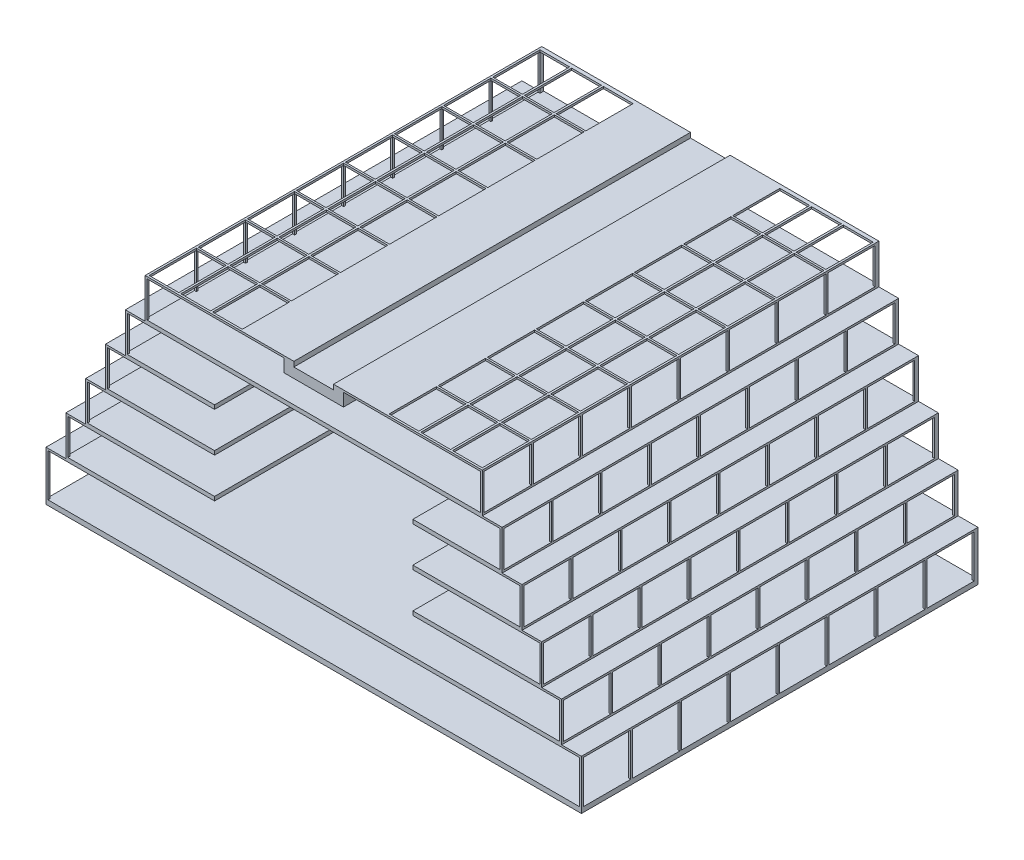
from build123d import *

# Parameters (mm, degrees)
EXTRUDE_1_DEPTH      = 40
SKETCH_2_W           = 4.77
SKETCH_2_H           = 3.6
CUT_EXTRUDE_1_DEPTH  = 11
CUT_EXTRUDE_2_REACH  = 56.351
SKETCH_3_W           = 3
SKETCH_3_H           = 4.77
SKETCH_4_W           = 4.77
SKETCH_4_H           = 3.6
CUT_EXTRUDE_3_DEPTH  = 11
SKETCH_5_W           = 4.77
SKETCH_5_H           = 3.6
CUT_EXTRUDE_4_DEPTH  = 11
SKETCH_6_W           = 4.77
SKETCH_6_H           = 3.6
CUT_EXTRUDE_5_DEPTH  = 11
SKETCH_7_W           = 4.77
SKETCH_7_H           = 3.6
CUT_EXTRUDE_6_DEPTH  = 11
SKETCH_8_W           = 4.77
SKETCH_8_H           = 4.3
CUT_EXTRUDE_7_DEPTH  = 11
SKETCH_9_W           = 37.6
SKETCH_9_H           = 3.6
SKETCH_9_W_2         = 41.6
SKETCH_9_W_3         = 45.6
SKETCH_9_W_4         = 49.6
SKETCH_9_W_5         = 53.6
SKETCH_9_H_2         = 4.3
CUT_EXTRUDE_9_DEPTH  = 55.350712967
SKETCH_10_W          = 20
SKETCH_10_H          = 12
CUT_EXTRUDE_10_DEPTH = 49


with BuildPart() as part:
    # 草图1 → 凸台-拉伸1 (new body)
    with BuildSketch(Plane.XY):
        Polygon((0, 24.5), (2, 24.5), (2, 25), (17, 25), (17, 21), (19, 21), (19, 17), (21, 17), (21, 13), (23, 13), (23, 9), (25, 9), (25, 5), (27, 5), (27, 0), (0, 0), align=None)
    extrude_1 = extrude(amount=-EXTRUDE_1_DEPTH)

    # 草图2 → 切除-拉伸1 (cut)
    with BuildSketch(Plane(origin=(17, 0, 0), x_dir=(0, 0, -1), z_dir=(1, 0, 0))):
        with Locations((2.585, 23)):
            Rectangle(SKETCH_2_W, SKETCH_2_H)
        with Locations((7.535, 23)):
            Rectangle(SKETCH_2_W, SKETCH_2_H)
        with Locations((12.485, 23)):
            Rectangle(SKETCH_2_W, SKETCH_2_H)
        with Locations((17.435, 23)):
            Rectangle(SKETCH_2_W, SKETCH_2_H)
        with Locations((22.385, 23)):
            Rectangle(SKETCH_2_W, SKETCH_2_H)
        with Locations((27.335, 23)):
            Rectangle(SKETCH_2_W, SKETCH_2_H)
        with Locations((32.285, 23)):
            Rectangle(SKETCH_2_W, SKETCH_2_H)
        with Locations((37.235, 23)):
            Rectangle(SKETCH_2_W, SKETCH_2_H)
    cut_extrude_1 = extrude(amount=-CUT_EXTRUDE_1_DEPTH, mode=Mode.SUBTRACT)

    # 草图3 → 切除-拉伸2 (cut, up to next)
    with BuildSketch(Plane(origin=(0, 25, 0), x_dir=(1, 0, 0), z_dir=(0, 1, 0)), mode=Mode.PRIVATE) as cut_extrude_2_sk1:
        with Locations((15.3, 2.585)):
            Rectangle(SKETCH_3_W, SKETCH_3_H)
    cut_extrude_2_tool1 = extrude(cut_extrude_2_sk1.sketch, amount=-CUT_EXTRUDE_2_REACH, mode=Mode.PRIVATE) & part.part
    # 草图3 → 切除-拉伸2 (cut, up to next)
    with BuildSketch(Plane(origin=(0, 25, 0), x_dir=(1, 0, 0), z_dir=(0, 1, 0)), mode=Mode.PRIVATE) as cut_extrude_2_sk2:
        with Locations((15.3, 7.535)):
            Rectangle(SKETCH_3_W, SKETCH_3_H)
    cut_extrude_2_tool2 = extrude(cut_extrude_2_sk2.sketch, amount=-CUT_EXTRUDE_2_REACH, mode=Mode.PRIVATE) & part.part
    # 草图3 → 切除-拉伸2 (cut, up to next)
    with BuildSketch(Plane(origin=(0, 25, 0), x_dir=(1, 0, 0), z_dir=(0, 1, 0)), mode=Mode.PRIVATE) as cut_extrude_2_sk3:
        with Locations((15.3, 12.485)):
            Rectangle(SKETCH_3_W, SKETCH_3_H)
    cut_extrude_2_tool3 = extrude(cut_extrude_2_sk3.sketch, amount=-CUT_EXTRUDE_2_REACH, mode=Mode.PRIVATE) & part.part
    # 草图3 → 切除-拉伸2 (cut, up to next)
    with BuildSketch(Plane(origin=(0, 25, 0), x_dir=(1, 0, 0), z_dir=(0, 1, 0)), mode=Mode.PRIVATE) as cut_extrude_2_sk4:
        with Locations((15.3, 17.435)):
            Rectangle(SKETCH_3_W, SKETCH_3_H)
    cut_extrude_2_tool4 = extrude(cut_extrude_2_sk4.sketch, amount=-CUT_EXTRUDE_2_REACH, mode=Mode.PRIVATE) & part.part
    # 草图3 → 切除-拉伸2 (cut, up to next)
    with BuildSketch(Plane(origin=(0, 25, 0), x_dir=(1, 0, 0), z_dir=(0, 1, 0)), mode=Mode.PRIVATE) as cut_extrude_2_sk5:
        with Locations((15.3, 22.385)):
            Rectangle(SKETCH_3_W, SKETCH_3_H)
    cut_extrude_2_tool5 = extrude(cut_extrude_2_sk5.sketch, amount=-CUT_EXTRUDE_2_REACH, mode=Mode.PRIVATE) & part.part
    # 草图3 → 切除-拉伸2 (cut, up to next)
    with BuildSketch(Plane(origin=(0, 25, 0), x_dir=(1, 0, 0), z_dir=(0, 1, 0)), mode=Mode.PRIVATE) as cut_extrude_2_sk6:
        with Locations((15.3, 27.335)):
            Rectangle(SKETCH_3_W, SKETCH_3_H)
    cut_extrude_2_tool6 = extrude(cut_extrude_2_sk6.sketch, amount=-CUT_EXTRUDE_2_REACH, mode=Mode.PRIVATE) & part.part
    # 草图3 → 切除-拉伸2 (cut, up to next)
    with BuildSketch(Plane(origin=(0, 25, 0), x_dir=(1, 0, 0), z_dir=(0, 1, 0)), mode=Mode.PRIVATE) as cut_extrude_2_sk7:
        with Locations((15.3, 32.285)):
            Rectangle(SKETCH_3_W, SKETCH_3_H)
    cut_extrude_2_tool7 = extrude(cut_extrude_2_sk7.sketch, amount=-CUT_EXTRUDE_2_REACH, mode=Mode.PRIVATE) & part.part
    # 草图3 → 切除-拉伸2 (cut, up to next)
    with BuildSketch(Plane(origin=(0, 25, 0), x_dir=(1, 0, 0), z_dir=(0, 1, 0)), mode=Mode.PRIVATE) as cut_extrude_2_sk8:
        with Locations((15.3, 37.235)):
            Rectangle(SKETCH_3_W, SKETCH_3_H)
    cut_extrude_2_tool8 = extrude(cut_extrude_2_sk8.sketch, amount=-CUT_EXTRUDE_2_REACH, mode=Mode.PRIVATE) & part.part
    # 草图3 → 切除-拉伸2 (cut, up to next)
    with BuildSketch(Plane(origin=(0, 25, 0), x_dir=(1, 0, 0), z_dir=(0, 1, 0)), mode=Mode.PRIVATE) as cut_extrude_2_sk9:
        with Locations((12.1, 2.585)):
            Rectangle(SKETCH_3_W, SKETCH_3_H)
    cut_extrude_2_tool9 = extrude(cut_extrude_2_sk9.sketch, amount=-CUT_EXTRUDE_2_REACH, mode=Mode.PRIVATE) & part.part
    # 草图3 → 切除-拉伸2 (cut, up to next)
    with BuildSketch(Plane(origin=(0, 25, 0), x_dir=(1, 0, 0), z_dir=(0, 1, 0)), mode=Mode.PRIVATE) as cut_extrude_2_sk10:
        with Locations((12.1, 7.535)):
            Rectangle(SKETCH_3_W, SKETCH_3_H)
    cut_extrude_2_tool10 = extrude(cut_extrude_2_sk10.sketch, amount=-CUT_EXTRUDE_2_REACH, mode=Mode.PRIVATE) & part.part
    # 草图3 → 切除-拉伸2 (cut, up to next)
    with BuildSketch(Plane(origin=(0, 25, 0), x_dir=(1, 0, 0), z_dir=(0, 1, 0)), mode=Mode.PRIVATE) as cut_extrude_2_sk11:
        with Locations((12.1, 12.485)):
            Rectangle(SKETCH_3_W, SKETCH_3_H)
    cut_extrude_2_tool11 = extrude(cut_extrude_2_sk11.sketch, amount=-CUT_EXTRUDE_2_REACH, mode=Mode.PRIVATE) & part.part
    # 草图3 → 切除-拉伸2 (cut, up to next)
    with BuildSketch(Plane(origin=(0, 25, 0), x_dir=(1, 0, 0), z_dir=(0, 1, 0)), mode=Mode.PRIVATE) as cut_extrude_2_sk12:
        with Locations((12.1, 17.435)):
            Rectangle(SKETCH_3_W, SKETCH_3_H)
    cut_extrude_2_tool12 = extrude(cut_extrude_2_sk12.sketch, amount=-CUT_EXTRUDE_2_REACH, mode=Mode.PRIVATE) & part.part
    # 草图3 → 切除-拉伸2 (cut, up to next)
    with BuildSketch(Plane(origin=(0, 25, 0), x_dir=(1, 0, 0), z_dir=(0, 1, 0)), mode=Mode.PRIVATE) as cut_extrude_2_sk13:
        with Locations((12.1, 22.385)):
            Rectangle(SKETCH_3_W, SKETCH_3_H)
    cut_extrude_2_tool13 = extrude(cut_extrude_2_sk13.sketch, amount=-CUT_EXTRUDE_2_REACH, mode=Mode.PRIVATE) & part.part
    # 草图3 → 切除-拉伸2 (cut, up to next)
    with BuildSketch(Plane(origin=(0, 25, 0), x_dir=(1, 0, 0), z_dir=(0, 1, 0)), mode=Mode.PRIVATE) as cut_extrude_2_sk14:
        with Locations((12.1, 27.335)):
            Rectangle(SKETCH_3_W, SKETCH_3_H)
    cut_extrude_2_tool14 = extrude(cut_extrude_2_sk14.sketch, amount=-CUT_EXTRUDE_2_REACH, mode=Mode.PRIVATE) & part.part
    # 草图3 → 切除-拉伸2 (cut, up to next)
    with BuildSketch(Plane(origin=(0, 25, 0), x_dir=(1, 0, 0), z_dir=(0, 1, 0)), mode=Mode.PRIVATE) as cut_extrude_2_sk15:
        with Locations((12.1, 32.285)):
            Rectangle(SKETCH_3_W, SKETCH_3_H)
    cut_extrude_2_tool15 = extrude(cut_extrude_2_sk15.sketch, amount=-CUT_EXTRUDE_2_REACH, mode=Mode.PRIVATE) & part.part
    # 草图3 → 切除-拉伸2 (cut, up to next)
    with BuildSketch(Plane(origin=(0, 25, 0), x_dir=(1, 0, 0), z_dir=(0, 1, 0)), mode=Mode.PRIVATE) as cut_extrude_2_sk16:
        with Locations((12.1, 37.235)):
            Rectangle(SKETCH_3_W, SKETCH_3_H)
    cut_extrude_2_tool16 = extrude(cut_extrude_2_sk16.sketch, amount=-CUT_EXTRUDE_2_REACH, mode=Mode.PRIVATE) & part.part
    # 草图3 → 切除-拉伸2 (cut, up to next)
    with BuildSketch(Plane(origin=(0, 25, 0), x_dir=(1, 0, 0), z_dir=(0, 1, 0)), mode=Mode.PRIVATE) as cut_extrude_2_sk17:
        with Locations((8.9, 2.585)):
            Rectangle(SKETCH_3_W, SKETCH_3_H)
    cut_extrude_2_tool17 = extrude(cut_extrude_2_sk17.sketch, amount=-CUT_EXTRUDE_2_REACH, mode=Mode.PRIVATE) & part.part
    # 草图3 → 切除-拉伸2 (cut, up to next)
    with BuildSketch(Plane(origin=(0, 25, 0), x_dir=(1, 0, 0), z_dir=(0, 1, 0)), mode=Mode.PRIVATE) as cut_extrude_2_sk18:
        with Locations((8.9, 7.535)):
            Rectangle(SKETCH_3_W, SKETCH_3_H)
    cut_extrude_2_tool18 = extrude(cut_extrude_2_sk18.sketch, amount=-CUT_EXTRUDE_2_REACH, mode=Mode.PRIVATE) & part.part
    # 草图3 → 切除-拉伸2 (cut, up to next)
    with BuildSketch(Plane(origin=(0, 25, 0), x_dir=(1, 0, 0), z_dir=(0, 1, 0)), mode=Mode.PRIVATE) as cut_extrude_2_sk19:
        with Locations((8.9, 12.485)):
            Rectangle(SKETCH_3_W, SKETCH_3_H)
    cut_extrude_2_tool19 = extrude(cut_extrude_2_sk19.sketch, amount=-CUT_EXTRUDE_2_REACH, mode=Mode.PRIVATE) & part.part
    # 草图3 → 切除-拉伸2 (cut, up to next)
    with BuildSketch(Plane(origin=(0, 25, 0), x_dir=(1, 0, 0), z_dir=(0, 1, 0)), mode=Mode.PRIVATE) as cut_extrude_2_sk20:
        with Locations((8.9, 17.435)):
            Rectangle(SKETCH_3_W, SKETCH_3_H)
    cut_extrude_2_tool20 = extrude(cut_extrude_2_sk20.sketch, amount=-CUT_EXTRUDE_2_REACH, mode=Mode.PRIVATE) & part.part
    # 草图3 → 切除-拉伸2 (cut, up to next)
    with BuildSketch(Plane(origin=(0, 25, 0), x_dir=(1, 0, 0), z_dir=(0, 1, 0)), mode=Mode.PRIVATE) as cut_extrude_2_sk21:
        with Locations((8.9, 22.385)):
            Rectangle(SKETCH_3_W, SKETCH_3_H)
    cut_extrude_2_tool21 = extrude(cut_extrude_2_sk21.sketch, amount=-CUT_EXTRUDE_2_REACH, mode=Mode.PRIVATE) & part.part
    # 草图3 → 切除-拉伸2 (cut, up to next)
    with BuildSketch(Plane(origin=(0, 25, 0), x_dir=(1, 0, 0), z_dir=(0, 1, 0)), mode=Mode.PRIVATE) as cut_extrude_2_sk22:
        with Locations((8.9, 27.335)):
            Rectangle(SKETCH_3_W, SKETCH_3_H)
    cut_extrude_2_tool22 = extrude(cut_extrude_2_sk22.sketch, amount=-CUT_EXTRUDE_2_REACH, mode=Mode.PRIVATE) & part.part
    # 草图3 → 切除-拉伸2 (cut, up to next)
    with BuildSketch(Plane(origin=(0, 25, 0), x_dir=(1, 0, 0), z_dir=(0, 1, 0)), mode=Mode.PRIVATE) as cut_extrude_2_sk23:
        with Locations((8.9, 32.285)):
            Rectangle(SKETCH_3_W, SKETCH_3_H)
    cut_extrude_2_tool23 = extrude(cut_extrude_2_sk23.sketch, amount=-CUT_EXTRUDE_2_REACH, mode=Mode.PRIVATE) & part.part
    # 草图3 → 切除-拉伸2 (cut, up to next)
    with BuildSketch(Plane(origin=(0, 25, 0), x_dir=(1, 0, 0), z_dir=(0, 1, 0)), mode=Mode.PRIVATE) as cut_extrude_2_sk24:
        with Locations((8.9, 37.235)):
            Rectangle(SKETCH_3_W, SKETCH_3_H)
    cut_extrude_2_tool24 = extrude(cut_extrude_2_sk24.sketch, amount=-CUT_EXTRUDE_2_REACH, mode=Mode.PRIVATE) & part.part
    cut_extrude_2_1 = cut_extrude_2_tool1.solids().sort_by_distance((15.3, 25, -2.585))[0]
    add(cut_extrude_2_1, mode=Mode.SUBTRACT)
    cut_extrude_2_2 = cut_extrude_2_tool2.solids().sort_by_distance((15.3, 25, -7.535))[0]
    add(cut_extrude_2_2, mode=Mode.SUBTRACT)
    cut_extrude_2_3 = cut_extrude_2_tool3.solids().sort_by_distance((15.3, 25, -12.485))[0]
    add(cut_extrude_2_3, mode=Mode.SUBTRACT)
    cut_extrude_2_4 = cut_extrude_2_tool4.solids().sort_by_distance((15.3, 25, -17.435))[0]
    add(cut_extrude_2_4, mode=Mode.SUBTRACT)
    cut_extrude_2_5 = cut_extrude_2_tool5.solids().sort_by_distance((15.3, 25, -22.385))[0]
    add(cut_extrude_2_5, mode=Mode.SUBTRACT)
    cut_extrude_2_6 = cut_extrude_2_tool6.solids().sort_by_distance((15.3, 25, -27.335))[0]
    add(cut_extrude_2_6, mode=Mode.SUBTRACT)
    cut_extrude_2_7 = cut_extrude_2_tool7.solids().sort_by_distance((15.3, 25, -32.285))[0]
    add(cut_extrude_2_7, mode=Mode.SUBTRACT)
    cut_extrude_2_8 = cut_extrude_2_tool8.solids().sort_by_distance((15.3, 25, -37.235))[0]
    add(cut_extrude_2_8, mode=Mode.SUBTRACT)
    cut_extrude_2_9 = cut_extrude_2_tool9.solids().sort_by_distance((12.1, 25, -2.585))[0]
    add(cut_extrude_2_9, mode=Mode.SUBTRACT)
    cut_extrude_2_10 = cut_extrude_2_tool10.solids().sort_by_distance((12.1, 25, -7.535))[0]
    add(cut_extrude_2_10, mode=Mode.SUBTRACT)
    cut_extrude_2_11 = cut_extrude_2_tool11.solids().sort_by_distance((12.1, 25, -12.485))[0]
    add(cut_extrude_2_11, mode=Mode.SUBTRACT)
    cut_extrude_2_12 = cut_extrude_2_tool12.solids().sort_by_distance((12.1, 25, -17.435))[0]
    add(cut_extrude_2_12, mode=Mode.SUBTRACT)
    cut_extrude_2_13 = cut_extrude_2_tool13.solids().sort_by_distance((12.1, 25, -22.385))[0]
    add(cut_extrude_2_13, mode=Mode.SUBTRACT)
    cut_extrude_2_14 = cut_extrude_2_tool14.solids().sort_by_distance((12.1, 25, -27.335))[0]
    add(cut_extrude_2_14, mode=Mode.SUBTRACT)
    cut_extrude_2_15 = cut_extrude_2_tool15.solids().sort_by_distance((12.1, 25, -32.285))[0]
    add(cut_extrude_2_15, mode=Mode.SUBTRACT)
    cut_extrude_2_16 = cut_extrude_2_tool16.solids().sort_by_distance((12.1, 25, -37.235))[0]
    add(cut_extrude_2_16, mode=Mode.SUBTRACT)
    cut_extrude_2_17 = cut_extrude_2_tool17.solids().sort_by_distance((8.9, 25, -2.585))[0]
    add(cut_extrude_2_17, mode=Mode.SUBTRACT)
    cut_extrude_2_18 = cut_extrude_2_tool18.solids().sort_by_distance((8.9, 25, -7.535))[0]
    add(cut_extrude_2_18, mode=Mode.SUBTRACT)
    cut_extrude_2_19 = cut_extrude_2_tool19.solids().sort_by_distance((8.9, 25, -12.485))[0]
    add(cut_extrude_2_19, mode=Mode.SUBTRACT)
    cut_extrude_2_20 = cut_extrude_2_tool20.solids().sort_by_distance((8.9, 25, -17.435))[0]
    add(cut_extrude_2_20, mode=Mode.SUBTRACT)
    cut_extrude_2_21 = cut_extrude_2_tool21.solids().sort_by_distance((8.9, 25, -22.385))[0]
    add(cut_extrude_2_21, mode=Mode.SUBTRACT)
    cut_extrude_2_22 = cut_extrude_2_tool22.solids().sort_by_distance((8.9, 25, -27.335))[0]
    add(cut_extrude_2_22, mode=Mode.SUBTRACT)
    cut_extrude_2_23 = cut_extrude_2_tool23.solids().sort_by_distance((8.9, 25, -32.285))[0]
    add(cut_extrude_2_23, mode=Mode.SUBTRACT)
    cut_extrude_2_24 = cut_extrude_2_tool24.solids().sort_by_distance((8.9, 25, -37.235))[0]
    add(cut_extrude_2_24, mode=Mode.SUBTRACT)
    cut_extrude_2 = cut_extrude_2_1 + cut_extrude_2_2 + cut_extrude_2_3 + cut_extrude_2_4 + cut_extrude_2_5 + cut_extrude_2_6 + cut_extrude_2_7 + cut_extrude_2_8 + cut_extrude_2_9 + cut_extrude_2_10 + cut_extrude_2_11 + cut_extrude_2_12 + cut_extrude_2_13 + cut_extrude_2_14 + cut_extrude_2_15 + cut_extrude_2_16 + cut_extrude_2_17 + cut_extrude_2_18 + cut_extrude_2_19 + cut_extrude_2_20 + cut_extrude_2_21 + cut_extrude_2_22 + cut_extrude_2_23 + cut_extrude_2_24  # 切除-拉伸2 as one shape, for the pattern or mirror that repeats it

    # 草图4 → 切除-拉伸3 (cut)
    with BuildSketch(Plane(origin=(19, 0, 0), x_dir=(0, 0, -1), z_dir=(1, 0, 0))):
        with Locations((2.585, 19)):
            Rectangle(SKETCH_4_W, SKETCH_4_H)
        with Locations((7.535, 19)):
            Rectangle(SKETCH_4_W, SKETCH_4_H)
        with Locations((12.485, 19)):
            Rectangle(SKETCH_4_W, SKETCH_4_H)
        with Locations((17.435, 19)):
            Rectangle(SKETCH_4_W, SKETCH_4_H)
        with Locations((22.385, 19)):
            Rectangle(SKETCH_4_W, SKETCH_4_H)
        with Locations((27.335, 19)):
            Rectangle(SKETCH_4_W, SKETCH_4_H)
        with Locations((32.285, 19)):
            Rectangle(SKETCH_4_W, SKETCH_4_H)
        with Locations((37.235, 19)):
            Rectangle(SKETCH_4_W, SKETCH_4_H)
    cut_extrude_3 = extrude(amount=-CUT_EXTRUDE_3_DEPTH, mode=Mode.SUBTRACT)

    # 草图5 → 切除-拉伸4 (cut)
    with BuildSketch(Plane(origin=(21, 0, 0), x_dir=(0, 0, -1), z_dir=(1, 0, 0))):
        with Locations((2.585, 15)):
            Rectangle(SKETCH_5_W, SKETCH_5_H)
        with Locations((7.535, 15)):
            Rectangle(SKETCH_5_W, SKETCH_5_H)
        with Locations((12.485, 15)):
            Rectangle(SKETCH_5_W, SKETCH_5_H)
        with Locations((17.435, 15)):
            Rectangle(SKETCH_5_W, SKETCH_5_H)
        with Locations((22.385, 15)):
            Rectangle(SKETCH_5_W, SKETCH_5_H)
        with Locations((27.335, 15)):
            Rectangle(SKETCH_5_W, SKETCH_5_H)
        with Locations((32.285, 15)):
            Rectangle(SKETCH_5_W, SKETCH_5_H)
        with Locations((37.235, 15)):
            Rectangle(SKETCH_5_W, SKETCH_5_H)
    cut_extrude_4 = extrude(amount=-CUT_EXTRUDE_4_DEPTH, mode=Mode.SUBTRACT)

    # 草图6 → 切除-拉伸5 (cut)
    with BuildSketch(Plane(origin=(23, 0, 0), x_dir=(0, 0, -1), z_dir=(1, 0, 0))):
        with Locations((2.585, 11)):
            Rectangle(SKETCH_6_W, SKETCH_6_H)
        with Locations((7.535, 11)):
            Rectangle(SKETCH_6_W, SKETCH_6_H)
        with Locations((12.485, 11)):
            Rectangle(SKETCH_6_W, SKETCH_6_H)
        with Locations((17.435, 11)):
            Rectangle(SKETCH_6_W, SKETCH_6_H)
        with Locations((22.385, 11)):
            Rectangle(SKETCH_6_W, SKETCH_6_H)
        with Locations((27.335, 11)):
            Rectangle(SKETCH_6_W, SKETCH_6_H)
        with Locations((32.285, 11)):
            Rectangle(SKETCH_6_W, SKETCH_6_H)
        with Locations((37.235, 11)):
            Rectangle(SKETCH_6_W, SKETCH_6_H)
    cut_extrude_5 = extrude(amount=-CUT_EXTRUDE_5_DEPTH, mode=Mode.SUBTRACT)

    # 草图7 → 切除-拉伸6 (cut)
    with BuildSketch(Plane(origin=(25, 0, 0), x_dir=(0, 0, -1), z_dir=(1, 0, 0))):
        with Locations((2.585, 7)):
            Rectangle(SKETCH_7_W, SKETCH_7_H)
        with Locations((7.535, 7)):
            Rectangle(SKETCH_7_W, SKETCH_7_H)
        with Locations((12.485, 7)):
            Rectangle(SKETCH_7_W, SKETCH_7_H)
        with Locations((17.435, 7)):
            Rectangle(SKETCH_7_W, SKETCH_7_H)
        with Locations((22.385, 7)):
            Rectangle(SKETCH_7_W, SKETCH_7_H)
        with Locations((27.335, 7)):
            Rectangle(SKETCH_7_W, SKETCH_7_H)
        with Locations((32.285, 7)):
            Rectangle(SKETCH_7_W, SKETCH_7_H)
        with Locations((37.235, 7)):
            Rectangle(SKETCH_7_W, SKETCH_7_H)
    cut_extrude_6 = extrude(amount=-CUT_EXTRUDE_6_DEPTH, mode=Mode.SUBTRACT)

    # 草图8 → 切除-拉伸7 (cut)
    with BuildSketch(Plane(origin=(27, 0, 0), x_dir=(0, 0, -1), z_dir=(1, 0, 0))):
        with Locations((2.585, 2.65)):
            Rectangle(SKETCH_8_W, SKETCH_8_H)
        with Locations((7.535, 2.65)):
            Rectangle(SKETCH_8_W, SKETCH_8_H)
        with Locations((12.485, 2.65)):
            Rectangle(SKETCH_8_W, SKETCH_8_H)
        with Locations((17.435, 2.65)):
            Rectangle(SKETCH_8_W, SKETCH_8_H)
        with Locations((22.385, 2.65)):
            Rectangle(SKETCH_8_W, SKETCH_8_H)
        with Locations((27.335, 2.65)):
            Rectangle(SKETCH_8_W, SKETCH_8_H)
        with Locations((32.285, 2.65)):
            Rectangle(SKETCH_8_W, SKETCH_8_H)
        with Locations((37.235, 2.65)):
            Rectangle(SKETCH_8_W, SKETCH_8_H)
    cut_extrude_7 = extrude(amount=-CUT_EXTRUDE_7_DEPTH, mode=Mode.SUBTRACT)

    # 镜向1: 凸台-拉伸1, 切除-拉伸1, 切除-拉伸2, 切除-拉伸3, 切除-拉伸4, 切除-拉伸5, 切除-拉伸6, 切除-拉伸7 across plane
    add(extrude_1.mirror(Plane(origin=(0, 0, 0), x_dir=(0, 0, 1), z_dir=(1, 0, 0))))
    add(cut_extrude_1.mirror(Plane(origin=(0, 0, 0), x_dir=(0, 0, 1), z_dir=(1, 0, 0))), mode=Mode.SUBTRACT)
    add(cut_extrude_2.mirror(Plane(origin=(0, 0, 0), x_dir=(0, 0, 1), z_dir=(1, 0, 0))), mode=Mode.SUBTRACT)
    add(cut_extrude_3.mirror(Plane(origin=(0, 0, 0), x_dir=(0, 0, 1), z_dir=(1, 0, 0))), mode=Mode.SUBTRACT)
    add(cut_extrude_4.mirror(Plane(origin=(0, 0, 0), x_dir=(0, 0, 1), z_dir=(1, 0, 0))), mode=Mode.SUBTRACT)
    add(cut_extrude_5.mirror(Plane(origin=(0, 0, 0), x_dir=(0, 0, 1), z_dir=(1, 0, 0))), mode=Mode.SUBTRACT)
    add(cut_extrude_6.mirror(Plane(origin=(0, 0, 0), x_dir=(0, 0, 1), z_dir=(1, 0, 0))), mode=Mode.SUBTRACT)
    add(cut_extrude_7.mirror(Plane(origin=(0, 0, 0), x_dir=(0, 0, 1), z_dir=(1, 0, 0))), mode=Mode.SUBTRACT)

    # 草图9 → 切除-拉伸9 (cut, through all)
    with BuildSketch(Plane.XY):
        Polygon((3, 24.8), (16.8, 24.8), (16.8, 21.2), (-16.8, 21.2), (-16.8, 24.8), (-3, 24.8), (-3, 23.5), (3, 23.5), align=None)
        with Locations((0, 19)):
            Rectangle(SKETCH_9_W, SKETCH_9_H)
        with Locations((0, 15)):
            Rectangle(SKETCH_9_W_2, SKETCH_9_H)
        with Locations((0, 11)):
            Rectangle(SKETCH_9_W_3, SKETCH_9_H)
        with Locations((0, 7)):
            Rectangle(SKETCH_9_W_4, SKETCH_9_H)
        with Locations((0, 2.65)):
            Rectangle(SKETCH_9_W_5, SKETCH_9_H_2)
    extrude(amount=-CUT_EXTRUDE_9_DEPTH, mode=Mode.SUBTRACT)

    # 草图10 → 切除-拉伸10 (cut)
    with BuildSketch(Plane(origin=(0, 0, -40), x_dir=(-1, 0, 0), z_dir=(0, 0, -1))):
        with Locations((0, 11.2)):
            Rectangle(SKETCH_10_W, SKETCH_10_H)
    extrude(amount=-CUT_EXTRUDE_10_DEPTH, mode=Mode.SUBTRACT)


solid = part.part
